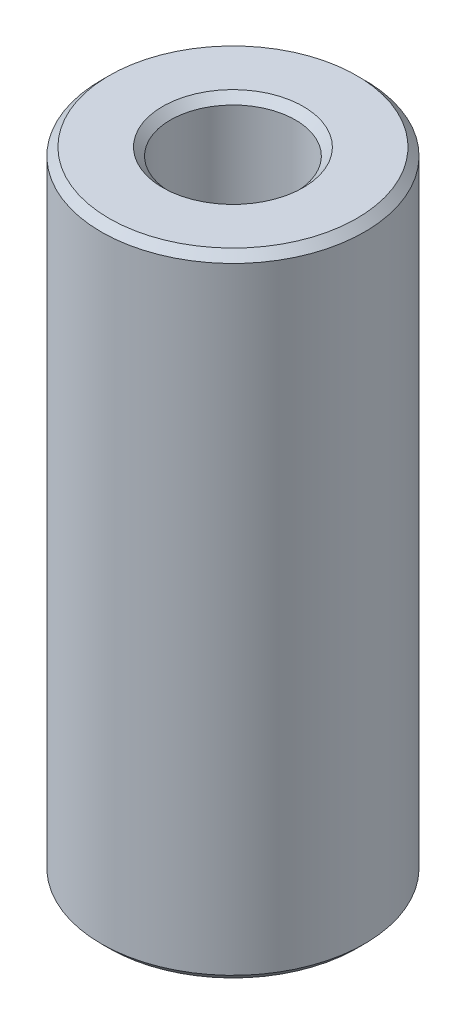
from build123d import *

# Parameters (mm, degrees)
SKETCH1_R           = 52.5
BOSS_EXTRUDE1_DEPTH = 252.163192355
SKETCH2_R           = 24.947194479
CUT_EXTRUDE1_DEPTH  = 263.866459592
CHAMFER1_SIZE       = 3.115764205


with BuildPart() as part:
    # Sketch1 → Boss-Extrude1 (new body)
    with BuildSketch(Plane(origin=(0, 0, 0), x_dir=(1, 0, 0), z_dir=(0, 1, 0))):
        Circle(SKETCH1_R)
    extrude(amount=BOSS_EXTRUDE1_DEPTH)

    # Sketch2 → Cut-Extrude1 (cut, through all)
    with BuildSketch(Plane(origin=(0, 0, 0), x_dir=(1, 0, 0), z_dir=(0, 1, 0))):
        Circle(SKETCH2_R)
    extrude(amount=CUT_EXTRUDE1_DEPTH, mode=Mode.SUBTRACT)

    # Chamfer1
    chamfer1_edges = [part.edges().sort_by_distance(p)[0] for p in [
        (-24.947194479, 252.163192355, 0),
        (-24.947194479, 0, 0),
        (-52.5, 0, 0),
        (-52.5, 252.163192355, 0),
    ]]
    chamfer(chamfer1_edges, length=CHAMFER1_SIZE)


solid = part.part
